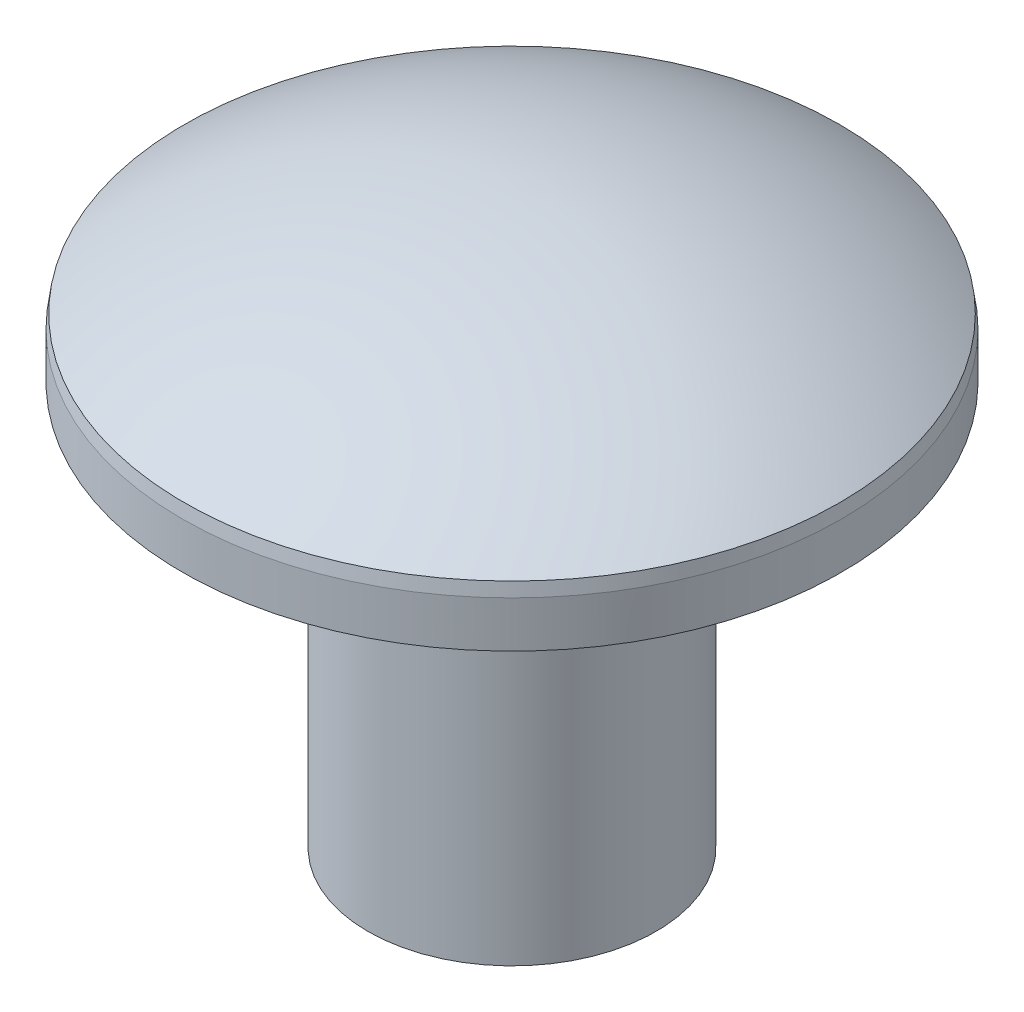
from build123d import *

# Parameters (mm, degrees)
CHAMFER1_SIZE       = 1.428571429
SKETCH7_R           = 28.571428571
BOSS_EXTRUDE2_DEPTH = 4
SKETCH8_R           = 12.5
BOSS_EXTRUDE3_DEPTH = 35


with BuildPart() as part:
    # Sketch1 → Revolve1 (revolve)
    with BuildSketch(Plane.XY, mode=Mode.PRIVATE) as revolve1_sk:
        with BuildLine():
            Line((0, 0), (-30, 0))
            ThreePointArc((-30, 0), (-15.811388301, 7.434164903), (0, 10))
            Line((0, 10), (0, 0))
        make_face()
    revolve(revolve1_sk.sketch.rotate(Axis((0, 0, 0), (0, 1, 0)), 180), axis=Axis((0, 0, 0), (0, 1, 0)))

    # Chamfer1
    # the kernel refuses this chamfer: 2, 1.428571429 mm, written as the material it takes off along each edge
    with BuildSketch(Plane(origin=(0, 0, 0), x_dir=(1, 0, 0), z_dir=(0, 0, 1))) as chamfer1_piece_1:
        with BuildLine():
            Line((30 - CHAMFER1_SIZE, 0), (28.407698006, 1.14611396))
            ThreePointArc((28.407698006, 1.14611396), (29.186973853, 0.597051091), (30, 0))
            Line((30, 0), (30 - CHAMFER1_SIZE, 0))
        make_face()
    revolve(axis=Axis((0, 0, 0), (0, 1, 0)), mode=Mode.SUBTRACT)

    # Sketch7 → Boss-Extrude2 (add)
    with BuildSketch(Plane.XZ):
        with Locations(Location((0, 0, 0), (0, 0, 270))):
            Circle(SKETCH7_R)
    extrude(amount=BOSS_EXTRUDE2_DEPTH)

    # Sketch8 → Boss-Extrude3 (add)
    with BuildSketch(Plane.XZ.offset(4)):
        with Locations(Location((0, 0, 0), (0, 0, 270))):
            Circle(SKETCH8_R)
    extrude(amount=BOSS_EXTRUDE3_DEPTH)


solid = part.part
